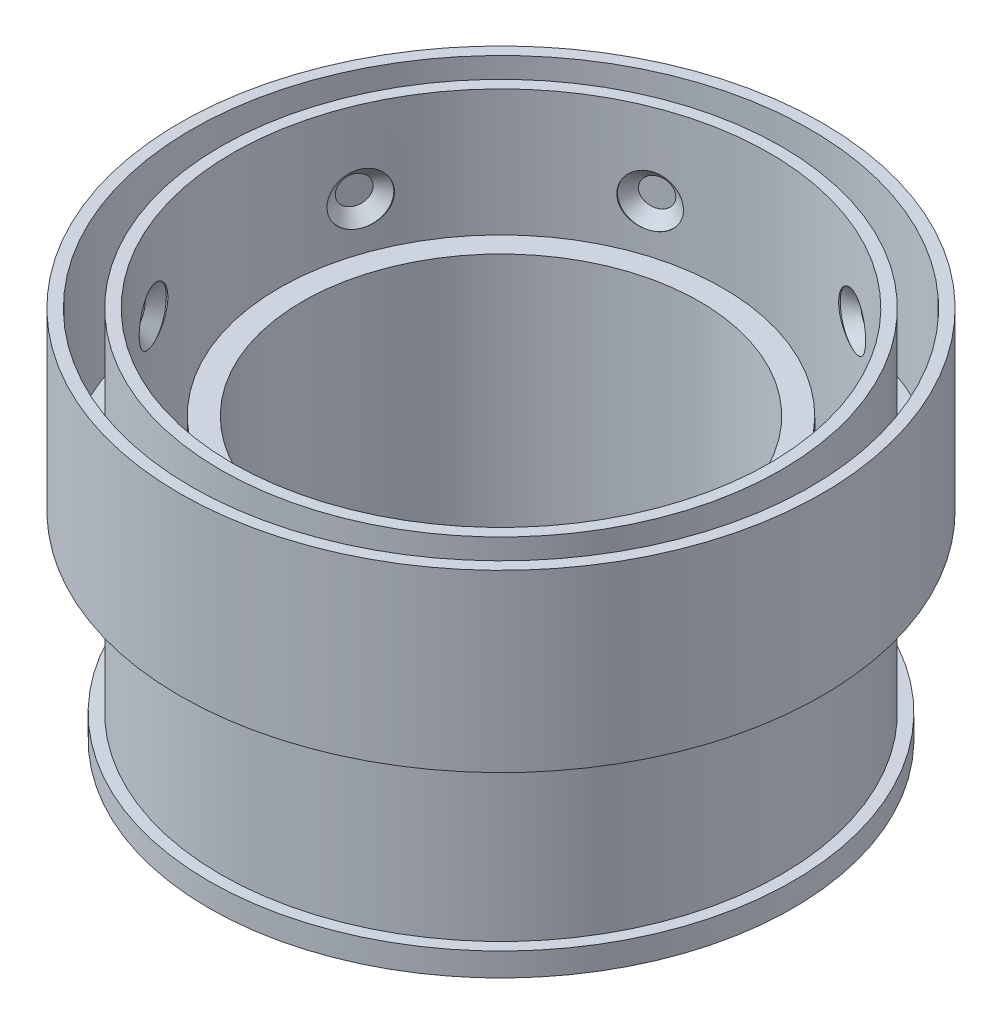
from build123d import *

# Parameters (mm, degrees)
SKETCH1_R                                = 25
BOSS_EXTRUDE1_DEPTH                      = 2
SKETCH2_R                                = 27.5
BOSS_EXTRUDE2_DEPTH                      = 2
SKETCH8_R                                = 22.5
CUT_EXTRUDE1_DEPTH                       = 5
SKETCH9_R                                = 27.5
BOSS_EXTRUDE5_DEPTH                      = 15
SKETCH11_R                               = 26.5
CUT_EXTRUDE3_DEPTH                       = 16
SKETCH12_R                               = 22.5
CUT_EXTRUDE4_DEPTH                       = 2.5
SKETCH14_R                               = 24
BOSS_EXTRUDE7_DEPTH                      = 15
SKETCH13_R                               = 23
CUT_EXTRUDE5_DEPTH                       = 15
SKETCH15_R                               = 19
BOSS_EXTRUDE8_DEPTH                      = 25
SKETCH16_R                               = 17
CUT_EXTRUDE6_DEPTH                       = 25
SKETCH18_R                               = 23
CUT_EXTRUDE7_DEPTH                       = 10
CUT_EXTRUDE8_START                       = -2
SKETCH21_R                               = 17
CUT_EXTRUDE8_DEPTH                       = 2
CSK_FOR_ST2_2_CROSS_RECESSED_CTSK_HE_2_W = 1.199982864
CSK_FOR_ST2_2_CROSS_RECESSED_CTSK_HE_2_H = 1.105521676
CIRPATTERN1_COUNT                        = 8


# Read off the part's stored shape, not the designer's step: CSK for ST2.2 Cross recessed CTSK head tapping screws1
with BuildPart() as part:
    # Sketch1 → Boss-Extrude1 (new body)
    with BuildSketch(Plane(origin=(0, 0, 0), x_dir=(1, 0, 0), z_dir=(0, 1, 0))):
        with Locations(Location((0, 0, 0), (0, 0, 270))):
            Circle(SKETCH1_R)
    extrude(amount=-BOSS_EXTRUDE1_DEPTH)

    # Sketch15 → Boss-Extrude8 (add)
    with BuildSketch(Plane(origin=(0, 0, 0), x_dir=(1, 0, 0), z_dir=(0, 1, 0))):
        with Locations(Location((0, 0, 0), (0, 0, 270))):
            Circle(SKETCH15_R)
    extrude(amount=BOSS_EXTRUDE8_DEPTH)

    # Sketch16 → Cut-Extrude6 (cut)
    with BuildSketch(Plane(origin=(0, 2, 0), x_dir=(1, 0, 0), z_dir=(0, 1, 0))):
        with Locations(Location((0, 0, 0), (0, 0, 270))):
            Circle(SKETCH16_R)
    extrude(amount=CUT_EXTRUDE6_DEPTH, mode=Mode.SUBTRACT)

    # Sketch18 → Cut-Extrude7 (cut, symmetric)
    with BuildSketch(Plane(origin=(0, 32, 0), x_dir=(1, 0, 0), z_dir=(0, 1, 0))):
        with Locations(Location((0, 0, 0), (0, 0, 270))):
            Circle(SKETCH18_R)
    extrude(amount=CUT_EXTRUDE7_DEPTH, both=True, mode=Mode.SUBTRACT)

    # Sketch21 → Cut-Extrude8 (cut)
    with BuildSketch(Plane(origin=(0, 2, 0), x_dir=(1, 0, 0), z_dir=(0, 1, 0)).offset(CUT_EXTRUDE8_START)):
        with Locations(Location((0, 0, 0), (0, 0, 270))):
            Circle(SKETCH21_R)
    extrude(amount=CUT_EXTRUDE8_DEPTH, mode=Mode.SUBTRACT)



with BuildPart() as body_2:
    # Sketch2 → Boss-Extrude2 (new body)
    with BuildSketch(Plane(origin=(0, 15, 0), x_dir=(1, 0, 0), z_dir=(0, 1, 0))):
        with Locations(Location((0, 0, 0), (0, 0, 270))):
            Circle(SKETCH2_R)
    extrude(amount=BOSS_EXTRUDE2_DEPTH)

    # Sketch8 → Cut-Extrude1 (cut, symmetric)
    with BuildSketch(Plane(origin=(0, 15, 0), x_dir=(1, 0, 0), z_dir=(0, 1, 0))):
        with Locations(Location((0, 0, 0), (0, 0, 270))):
            Circle(SKETCH8_R)
    extrude(amount=CUT_EXTRUDE1_DEPTH, both=True, mode=Mode.SUBTRACT)

    # Sketch9 → Boss-Extrude5 (add)
    with BuildSketch(Plane(origin=(0, 15, 0), x_dir=(1, 0, 0), z_dir=(0, 1, 0))):
        with Locations(Location((0, 0, 0), (0, 0, 270))):
            Circle(SKETCH9_R)
    extrude(amount=BOSS_EXTRUDE5_DEPTH)

    # Sketch11 → Cut-Extrude3 (cut)
    with BuildSketch(Plane(origin=(0, 17, 0), x_dir=(1, 0, 0), z_dir=(0, 1, 0))):
        with Locations(Location((0, 0, 0), (0, 0, 270))):
            Circle(SKETCH11_R)
    extrude(amount=CUT_EXTRUDE3_DEPTH, mode=Mode.SUBTRACT)

    # Sketch12 → Cut-Extrude4 (cut, symmetric)
    with BuildSketch(Plane(origin=(0, 17, 0), x_dir=(1, 0, 0), z_dir=(0, 1, 0))):
        with Locations(Location((0, 0, 0), (0, 0, 270))):
            Circle(SKETCH12_R)
    extrude(amount=CUT_EXTRUDE4_DEPTH, both=True, mode=Mode.SUBTRACT)

    # Sketch14 → Boss-Extrude7 (add, symmetric)
    with BuildSketch(Plane(origin=(0, 15, 0), x_dir=(1, 0, 0), z_dir=(0, 1, 0))):
        with Locations(Location((0, 0, 0), (0, 0, 270))):
            Circle(SKETCH14_R)
    extrude(amount=BOSS_EXTRUDE7_DEPTH, both=True)

    # Sketch13 → Cut-Extrude5 (cut, symmetric)
    with BuildSketch(Plane(origin=(0, 15, 0), x_dir=(1, 0, 0), z_dir=(0, 1, 0))):
        with Locations(Location((0, 0, 0), (0, 0, 270))):
            Circle(SKETCH13_R)
    extrude(amount=CUT_EXTRUDE5_DEPTH, both=True, mode=Mode.SUBTRACT)

    # CSK for ST2.2 Cross recessed CTSK he 2 → CSK for ST2.2 Cross recessed CTSK head tapping screws1 (revolve, cut)
    with BuildSketch(Plane(origin=(0, 23.006279741, 0), x_dir=(0, 1, 0), z_dir=(0.39435160733302504, 0, -0.9189596344746921))):
        Polygon((1.199982864, -24.000017136), (2.2, -23), (2.2, -22.894497482), (1.199982864, -22.89449546), align=None)
        with Locations((0.599991432, -23.447256298)):
            Rectangle(CSK_FOR_ST2_2_CROSS_RECESSED_CTSK_HE_2_W, CSK_FOR_ST2_2_CROSS_RECESSED_CTSK_HE_2_H)
    csk_for_st2_2_cross_recessed_ctsk_head_t = revolve(axis=Axis((0, 23.006279741, 0), (0.9189596344746921, 0, 0.39435160733302504)), mode=Mode.SUBTRACT)

    # CirPattern1: CSK for ST2.2 Cross recessed CTSK head tapping screws1 ×8 about axis
    cirpattern1_axis = Axis((0, 30, 0), (0, 1, 0))
    for i in range(1, CIRPATTERN1_COUNT):
        add(csk_for_st2_2_cross_recessed_ctsk_head_t.rotate(cirpattern1_axis, i * 360 / CIRPATTERN1_COUNT), mode=Mode.SUBTRACT)


with BuildPart() as part_1:
    add(part.part)

    add(body_2.part)  # Revolve1 merges body 2
    # Sketch23 → Revolve1 (revolve)
    with BuildSketch(Plane(origin=(0, 18, 0), x_dir=(1, 0, 0), z_dir=(0, 1, 0))):
        with BuildLine():
            Line((0, -19), (0, -20))
            ThreePointArc((0, -20), (0.841409608, -19.540397883), (0.909391942, -18.584059744))
            Line((0.909391942, -18.584059744), (0, -19))
        make_face()
    revolve(axis=Axis((0, 18, 19), (0, 0, 1)))


solid = part_1.part
